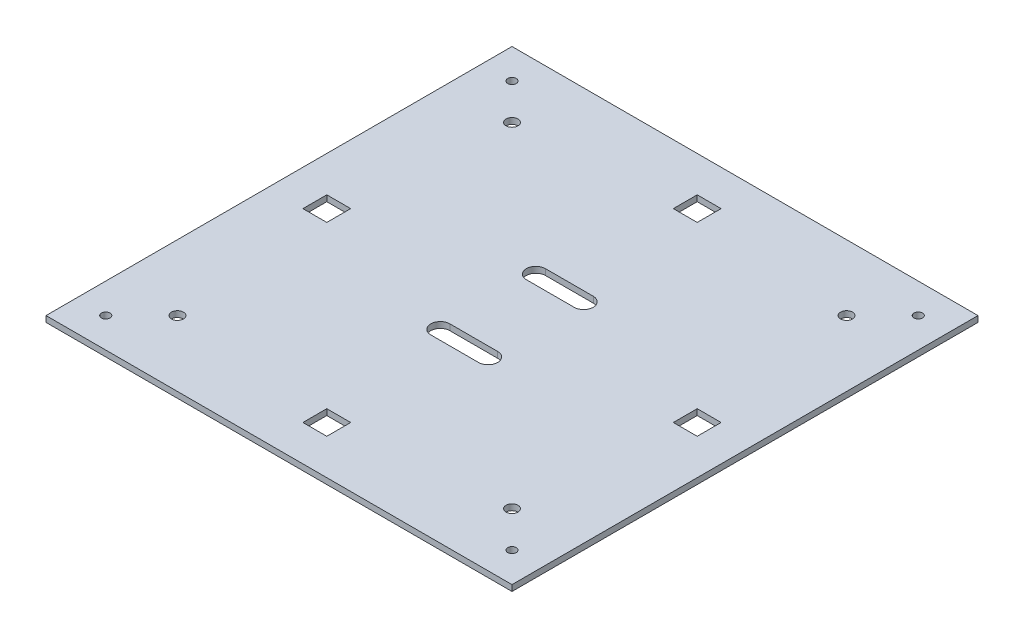
from build123d import *

# Parameters (mm, degrees)
SKETCH1_W                    = 241.3
SKETCH1_H                    = 241.3
MAIN_BODY_DEPTH              = 3.175
SKETCH2_R                    = 3.175
SKETCH2_R_2                  = 2.286
SCREW_AND_STRING_HOLES_DEPTH = 342.264502439
SKETCH3_W                    = 247.65
SKETCH3_H                    = 247.65
SKETCH3_W_2                  = 241.3
SKETCH3_H_2                  = 241.3
SLIGHT_EXPANSION_DEPTH       = 3.175
SKETCH4_W                    = 12.7
SKETCH4_H                    = 12.7
LED_HOLES_DEPTH              = 346.754438692
EXTERNAL_CABLE_SLOTS_DEPTH   = 346.754438692


with BuildPart() as part:
    # Sketch1 → Main Body (new body)
    with BuildSketch(Plane(origin=(0, 0, 0), x_dir=(1, 0, 0), z_dir=(0, 1, 0))):
        with Locations((120.65, 120.65)):
            Rectangle(SKETCH1_W, SKETCH1_H)
    extrude(amount=MAIN_BODY_DEPTH)

    # Sketch2 → Screw and String Holes (cut, through all)
    with BuildSketch(Plane(origin=(0, 3.175, 0), x_dir=(1, 0, 0), z_dir=(0, 1, 0))):
        with Locations((209.55, 31.75)):
            Circle(SKETCH2_R)
        with Locations((31.75, 31.75)):
            Circle(SKETCH2_R)
        with Locations((31.75, 209.55)):
            Circle(SKETCH2_R)
        with Locations((209.55, 209.55)):
            Circle(SKETCH2_R)
        with Locations((228.6, 12.7)):
            Circle(SKETCH2_R_2)
        with Locations((12.7, 12.7)):
            Circle(SKETCH2_R_2)
        with Locations((12.7, 228.6)):
            Circle(SKETCH2_R_2)
        with Locations((228.6, 228.6)):
            Circle(SKETCH2_R_2)
    extrude(amount=-SCREW_AND_STRING_HOLES_DEPTH, mode=Mode.SUBTRACT)

    # Sketch3 → Slight Expansion (add)
    with BuildSketch(Plane(origin=(0, 3.175, 0), x_dir=(1, 0, 0), z_dir=(0, 1, 0))):
        with Locations((120.65, 120.65)):
            Rectangle(SKETCH3_W, SKETCH3_H)
        with Locations((120.65, 120.65)):
            Rectangle(SKETCH3_W_2, SKETCH3_H_2, mode=Mode.SUBTRACT)
    extrude(amount=-SLIGHT_EXPANSION_DEPTH)

    # Sketch4 → LED Holes (cut, through all)
    with BuildSketch(Plane(origin=(0, 3.175, 0), x_dir=(1, 0, 0), z_dir=(0, 1, 0))):
        with Locations((120.65, 22.225)):
            Rectangle(SKETCH4_W, SKETCH4_H)
        with Locations((22.225, 120.65)):
            Rectangle(SKETCH4_W, SKETCH4_H)
        with Locations((120.65, 219.075)):
            Rectangle(SKETCH4_W, SKETCH4_H)
        with Locations((219.075, 120.65)):
            Rectangle(SKETCH4_W, SKETCH4_H)
    extrude(amount=-LED_HOLES_DEPTH, mode=Mode.SUBTRACT)

    # Sketch5 → External Cable Slots (cut, through all)
    with BuildSketch(Plane(origin=(0, 3.175, 0), x_dir=(1, 0, 0), z_dir=(0, 1, 0))):
        with BuildLine():
            Line((107.95, 100.33), (133.35, 100.33))
            ThreePointArc((133.35, 100.33), (138.43, 95.25), (133.35, 90.17))
            Line((133.35, 90.17), (107.95, 90.17))
            ThreePointArc((107.95, 90.17), (102.87, 95.25), (107.95, 100.33))
        make_face()
        with BuildLine():
            Line((107.95, 151.13), (133.35, 151.13))
            ThreePointArc((133.35, 151.13), (138.43, 146.05), (133.35, 140.97))
            Line((133.35, 140.97), (107.95, 140.97))
            ThreePointArc((107.95, 140.97), (102.87, 146.05), (107.95, 151.13))
        make_face()
    extrude(amount=-EXTERNAL_CABLE_SLOTS_DEPTH, mode=Mode.SUBTRACT)


solid = part.part
